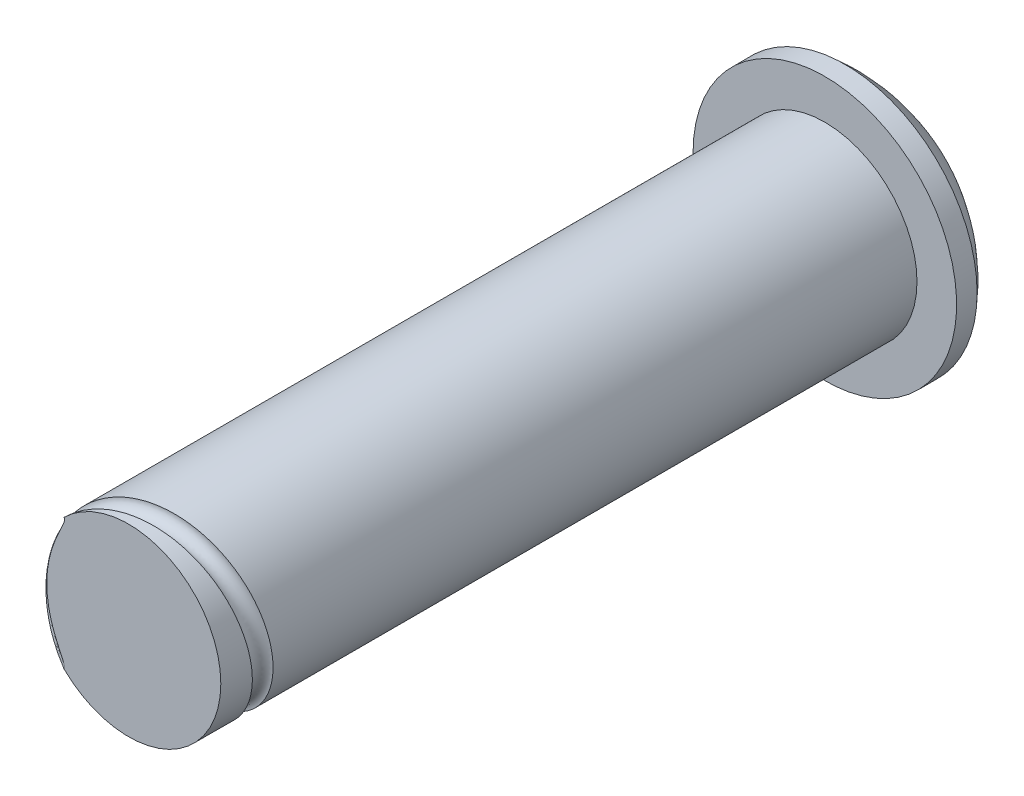
from build123d import *

# Parameters (mm, degrees)
SKETCH1_R           = 45
BOSS_EXTRUDE1_DEPTH = 340
SKETCH2_R           = 64.360130449
BOSS_EXTRUDE2_DEPTH = 10
DOME1_FACE_RADIUS   = 64.360130449
DOME1_HEIGHT        = 30
CUT_SWEEP2_PITCH    = 40


with BuildPart() as part:
    # Sketch1 → Boss-Extrude1 (new body)
    with BuildSketch(Plane.XY):
        Circle(SKETCH1_R)
    extrude(amount=BOSS_EXTRUDE1_DEPTH)

    # Sketch2 → Boss-Extrude2 (add)
    with BuildSketch(Plane(origin=(0, 0, 0), x_dir=(-1, 0, 0), z_dir=(0, 0, -1))):
        Circle(SKETCH2_R)
    extrude(amount=BOSS_EXTRUDE2_DEPTH)

    # Dome1: a dome of height H over a round flat face of radius A is a cap of a sphere of radius (A * A + H * H) / (2 * H)
    dome1_r = (DOME1_FACE_RADIUS * DOME1_FACE_RADIUS + DOME1_HEIGHT * DOME1_HEIGHT) / (2 * DOME1_HEIGHT)
    dome1_base = Plane((0, 0, -10), z_dir=(0, 0, -1))
    with Locations(dome1_base.offset(DOME1_HEIGHT - dome1_r)):
        dome1_ball = Sphere(dome1_r, mode=Mode.PRIVATE)
    add(split(dome1_ball, bisect_by=dome1_base, keep=Keep.TOP, mode=Mode.PRIVATE))

    # Cut-Sweep2: arcs per turn and ends read off the stored shape
    # Cut-Sweep2: the profile of Cut-Sweep2 profile screwed along a right-hand helix through 2 turns, 26 arcs to a turn; built about Z, then put on its axis
    cut_sweep2_z = Axis((0, 0, 0), (0, 0, 1))
    cut_sweep2_corners = [(45, 0.700381287, -44.950703592), (40, 0, -40), (45, -0.700381287, -35.049296408), (50, 0, -40)]
    with BuildLine(mode=Mode.PRIVATE) as cut_sweep2_profile:
        ThreePointArc((45, 0.700381287, -44.950703592), (41.464466094, 0.495244358, -43.500676081), (40, 0, -40))
        ThreePointArc((40, 0, -40), (41.464466094, -0.495244358, -36.499323919), (45, -0.700381287, -35.049296408))
        ThreePointArc((45, -0.700381287, -35.049296408), (48.535533906, -0.495244358, -36.499323919), (50, 0, -40))
        ThreePointArc((50, 0, -40), (48.535533906, 0.495244358, -43.500676081), (45, 0.700381287, -44.950703592))
    cut_sweep2_cap = Face(cut_sweep2_profile.wire())
    cut_sweep2_arcs = [((45, 0.700381287, -44.950703592), (40, 0.700381287, -44.950703592), (40, 0, -40), (1, 0.7071067811865476, 1)), ((40, 0, -40), (40, -0.700381287, -35.049296408), (45, -0.700381287, -35.049296408), (1, 0.7071067811865476, 1)), ((45, -0.700381287, -35.049296408), (50, -0.700381287, -35.049296408), (50, 0, -40), (1, 0.7071067811865476, 1)), ((50, 0, -40), (50, 0.700381287, -44.950703592), (45, 0.700381287, -44.950703592), (1, 0.7071067811865476, 1))]  # start, shoulder, end, weights
    cut_sweep2_turn_angles = [0, 6.923076923, 13.846153846, 20.769230769, 27.692307692, 34.615384615, 41.538461538, 48.461538462, 55.384615385, 62.307692308, 69.230769231, 76.153846154, 83.076923077, 90, 96.923076923, 103.846153846, 110.769230769, 117.692307692, 124.615384615, 131.538461538, 138.461538462, 145.384615385, 152.307692308, 159.230769231, 166.153846154, 173.076923077, 180, 186.923076923, 193.846153846, 200.769230769, 207.692307692, 214.615384615, 221.538461538, 228.461538462, 235.384615385, 242.307692308, 249.230769231, 256.153846154, 263.076923077, 270, 276.923076923, 283.846153846, 290.769230769, 297.692307692, 304.615384615, 311.538461538, 318.461538462, 325.384615385, 332.307692308, 339.230769231, 346.153846154, 353.076923077, 360]
    cut_sweep2_turn_weights = [1, 0.992708874098054, 1, 0.992708874098054, 1, 0.992708874098054, 1, 0.992708874098054, 1, 0.992708874098054, 1, 0.992708874098054, 1, 0.992708874098054, 1, 0.992708874098054, 1, 0.992708874098054, 1, 0.992708874098054, 1, 0.992708874098054, 1, 0.992708874098054, 1, 0.992708874098054, 1, 0.992708874098054, 1, 0.992708874098054, 1, 0.992708874098054, 1, 0.992708874098054, 1, 0.992708874098054, 1, 0.992708874098054, 1, 0.9927088740980541, 1, 0.992708874098054, 1, 0.992708874098054, 1, 0.9927088740980541, 1, 0.992708874098054, 1, 0.992708874098054, 1, 0.9927088740980541, 1]
    cut_sweep2_turn_sides = [Face.make_bezier_surface([[Vector(p[j][0], p[j][1], 0).rotate(cut_sweep2_z, cut_sweep2_turn_angles[2 * i + k]) / cut_sweep2_turn_weights[2 * i + k] + Vector(0, 0, p[j][2] + CUT_SWEEP2_PITCH * cut_sweep2_turn_angles[2 * i + k] / 360) for k in range(3)] for j in range(3)], [[p[3][j] * cut_sweep2_turn_weights[2 * i + k] for k in range(3)] for j in range(3)]) for p in cut_sweep2_arcs for i in range(26)]
    cut_sweep2 = Plane(origin=(0, 0, 340), x_dir=(-1, 0, 0), z_dir=(0, 0, -1)) * Solid(Shell([*[p.moved(Location((0, 0, CUT_SWEEP2_PITCH * i))) for i in range(2) for p in cut_sweep2_turn_sides], cut_sweep2_cap, cut_sweep2_cap.rotate(cut_sweep2_z, 720).moved(Location((0, 0, CUT_SWEEP2_PITCH * 720 / 360)))]))
    add(cut_sweep2, mode=Mode.SUBTRACT)


solid = part.part
